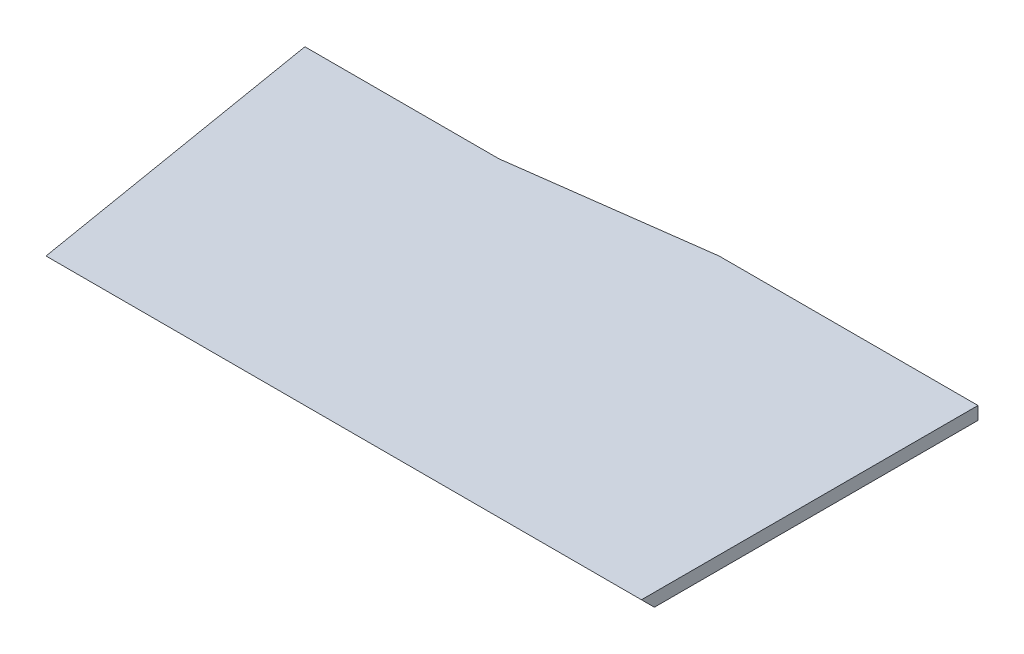
from build123d import *

# Parameters (mm, degrees)
BOSS_EXTRUDE1_DEPTH = 2
CHAMFER1_SIZE       = 2


with BuildPart() as part:
    # Sketch1 → Boss-Extrude1 (new body)
    with BuildSketch(Plane(origin=(0, 0, 0), x_dir=(1, 0, 0), z_dir=(0, 1, 0))):
        Polygon((0, -50), (0, 0), (0, 2), (-40, 2), (-70, -2), (-100, -2), (-92, -50), align=None)
    extrude(amount=BOSS_EXTRUDE1_DEPTH)

    # Chamfer1
    chamfer1_edges = [part.edges().sort_by_distance(p)[0] for p in [
        (-46, 0, 50),
    ]]
    chamfer(chamfer1_edges, length=CHAMFER1_SIZE - 0.0001)  # a hair under: the kernel refuses the full size


solid = part.part
